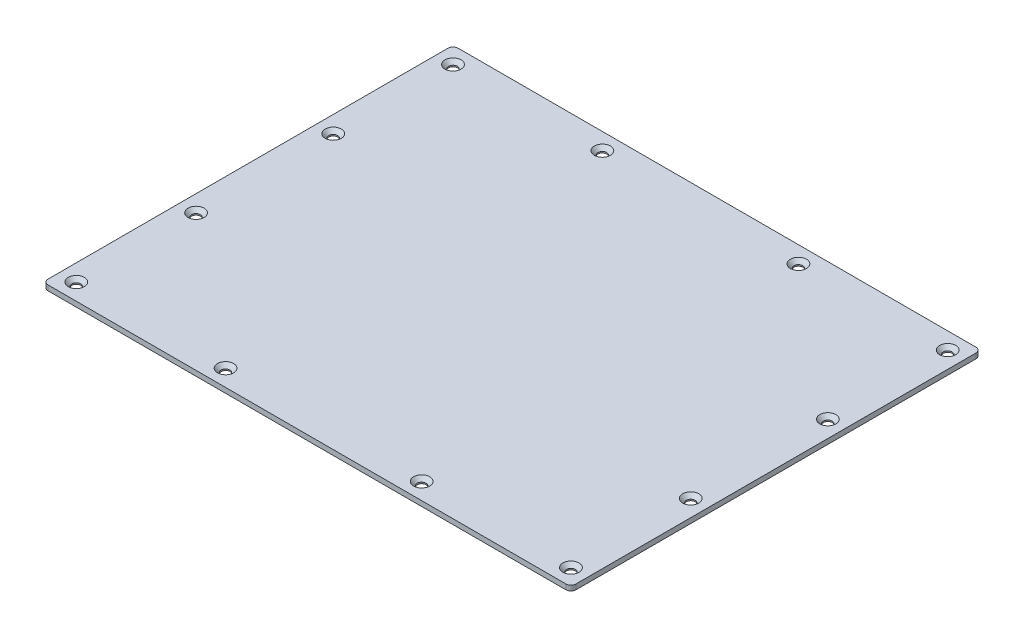
from build123d import *

# Parameters (mm, degrees)
BOSS_EXTRUDE1_DEPTH                            = 2
CSK_FOR_M3_FLAT_HEAD_MACHINE_SCREW1_AT_2_COUNT = 2
CSK_FOR_M3_FLAT_HEAD_MACHINE_SCREW1_AT_2_PITCH = 46.75
CSK_FOR_M3_FLAT_HEAD_MACHINE_SCREW1_AT_3_COUNT = 2
CSK_FOR_M3_FLAT_HEAD_MACHINE_SCREW1_AT_3_PITCH = 58.25
CSK_FOR_M3_FLAT_HEAD_MACHINE_SCREW1_AT_4_COUNT = 2
CSK_FOR_M3_FLAT_HEAD_MACHINE_SCREW1_AT_4_PITCH = 134.75
CSK_FOR_M3_FLAT_HEAD_MACHINE_SCREW1_AT_5_COUNT = 2
CSK_FOR_M3_FLAT_HEAD_MACHINE_SCREW1_AT_5_PITCH = 193
CSK_FOR_M3_FLAT_HEAD_MACHINE_SCREW1_AT_6_COUNT = 2
CSK_FOR_M3_FLAT_HEAD_MACHINE_SCREW1_AT_6_PITCH = 198.581375008
CSK_FOR_M3_FLAT_HEAD_MACHINE_SCREW1_AT_7_COUNT = 2
CSK_FOR_M3_FLAT_HEAD_MACHINE_SCREW1_AT_7_PITCH = 217.483476384
CSK_FOR_M3_FLAT_HEAD_MACHINE_SCREW1_AT_8_COUNT = 2
CSK_FOR_M3_FLAT_HEAD_MACHINE_SCREW1_AT_8_PITCH = 242.606677567
CSK_FOR_M3_FLAT_HEAD_MACHINE_SCREW1_AT_9_COUNT = 2
CSK_FOR_M3_FLAT_HEAD_MACHINE_SCREW1_AT_9_PITCH = 199.415552302
CSK_FOR_M3_FLAT_HEAD_MACHINE_SCREW1_AT_1_COUNT = 2
CSK_FOR_M3_FLAT_HEAD_MACHINE_SCREW1_AT_1_PITCH = 158.120405072
CSK_FOR_M3_FLAT_HEAD_MACHINE_SCREW1_2_COUNT    = 2
CSK_FOR_M3_FLAT_HEAD_MACHINE_SCREW1_2_PITCH    = 147
CSK_FOR_M3_FLAT_HEAD_MACHINE_SCREW1_3_COUNT    = 2
CSK_FOR_M3_FLAT_HEAD_MACHINE_SCREW1_3_PITCH    = 100.25


with BuildPart() as part:
    # Sketch1 → Boss-Extrude1 (new body)
    with BuildSketch(Plane(origin=(0, 0, 0), x_dir=(1, 0, 0), z_dir=(0, 1, 0))):
        with BuildLine():
            Line((103, -78), (103, 78))
            ThreePointArc((103, 78), (102.414213562, 79.414213562), (101, 80))
            Line((101, 80), (-101, 80))
            ThreePointArc((-101, 80), (-102.414213562, 79.414213562), (-103, 78))
            Line((-103, 78), (-103, -78))
            ThreePointArc((-103, -78), (-102.414213562, -79.414213562), (-101, -80))
            Line((-101, -80), (101, -80))
            ThreePointArc((101, -80), (102.414213562, -79.414213562), (103, -78))
        make_face()
    extrude(amount=BOSS_EXTRUDE1_DEPTH)

    # Sketch3 → CSK for M3 Flat Head Machine Screw1 (revolve, cut)
    with BuildSketch(Plane(origin=(-96.5, 2, -73.5), x_dir=(0, 0, 1), z_dir=(1, 0, 0))):
        Polygon((0, 0), (0, 2), (1.725, 2), (1.7, 1.975), (1.7, 1.45), (3.15, 0), align=None)
    csk_for_m3_flat_head_machine_screw1 = revolve(axis=Axis((-96.5, 8.35, -73.5), (0, -1, 0)), mode=Mode.SUBTRACT)

    # CSK for M3 Flat Head Machine Screw1 at 2: CSK for M3 Flat Head Machine Screw1 ×2
    with Locations(*[(0, 0, i * CSK_FOR_M3_FLAT_HEAD_MACHINE_SCREW1_AT_2_PITCH) for i in range(1, CSK_FOR_M3_FLAT_HEAD_MACHINE_SCREW1_AT_2_COUNT)]):
        add(csk_for_m3_flat_head_machine_screw1, mode=Mode.SUBTRACT)

    # CSK for M3 Flat Head Machine Screw1 at 3: CSK for M3 Flat Head Machine Screw1 ×2
    with Locations(*[(i * CSK_FOR_M3_FLAT_HEAD_MACHINE_SCREW1_AT_3_PITCH, 0, 0) for i in range(1, CSK_FOR_M3_FLAT_HEAD_MACHINE_SCREW1_AT_3_COUNT)]):
        add(csk_for_m3_flat_head_machine_screw1, mode=Mode.SUBTRACT)

    # CSK for M3 Flat Head Machine Screw1 at 4: CSK for M3 Flat Head Machine Screw1 ×2
    with Locations(*[(i * CSK_FOR_M3_FLAT_HEAD_MACHINE_SCREW1_AT_4_PITCH, 0, 0) for i in range(1, CSK_FOR_M3_FLAT_HEAD_MACHINE_SCREW1_AT_4_COUNT)]):
        add(csk_for_m3_flat_head_machine_screw1, mode=Mode.SUBTRACT)

    # CSK for M3 Flat Head Machine Screw1 at 5: CSK for M3 Flat Head Machine Screw1 ×2
    with Locations(*[(i * CSK_FOR_M3_FLAT_HEAD_MACHINE_SCREW1_AT_5_PITCH, 0, 0) for i in range(1, CSK_FOR_M3_FLAT_HEAD_MACHINE_SCREW1_AT_5_COUNT)]):
        add(csk_for_m3_flat_head_machine_screw1, mode=Mode.SUBTRACT)

    # CSK for M3 Flat Head Machine Screw1 at 6: CSK for M3 Flat Head Machine Screw1 ×2
    with Locations(*[Vector(0.9718937639161328, 0, 0.2354198625030021) * (i * CSK_FOR_M3_FLAT_HEAD_MACHINE_SCREW1_AT_6_PITCH) for i in range(1, CSK_FOR_M3_FLAT_HEAD_MACHINE_SCREW1_AT_6_COUNT)]):
        add(csk_for_m3_flat_head_machine_screw1, mode=Mode.SUBTRACT)

    # CSK for M3 Flat Head Machine Screw1 at 7: CSK for M3 Flat Head Machine Screw1 ×2
    with Locations(*[Vector(0.8874237399965582, 0, 0.46095455924691864) * (i * CSK_FOR_M3_FLAT_HEAD_MACHINE_SCREW1_AT_7_PITCH) for i in range(1, CSK_FOR_M3_FLAT_HEAD_MACHINE_SCREW1_AT_7_COUNT)]):
        add(csk_for_m3_flat_head_machine_screw1, mode=Mode.SUBTRACT)

    # CSK for M3 Flat Head Machine Screw1 at 8: CSK for M3 Flat Head Machine Screw1 ×2
    with Locations(*[Vector(0.7955263306668907, 0, 0.6059190186944727) * (i * CSK_FOR_M3_FLAT_HEAD_MACHINE_SCREW1_AT_8_PITCH) for i in range(1, CSK_FOR_M3_FLAT_HEAD_MACHINE_SCREW1_AT_8_COUNT)]):
        add(csk_for_m3_flat_head_machine_screw1, mode=Mode.SUBTRACT)

    # CSK for M3 Flat Head Machine Screw1 at 9: CSK for M3 Flat Head Machine Screw1 ×2
    with Locations(*[Vector(0.6757246285173452, 0, 0.7371541402007424) * (i * CSK_FOR_M3_FLAT_HEAD_MACHINE_SCREW1_AT_9_PITCH) for i in range(1, CSK_FOR_M3_FLAT_HEAD_MACHINE_SCREW1_AT_9_COUNT)]):
        add(csk_for_m3_flat_head_machine_screw1, mode=Mode.SUBTRACT)

    # CSK for M3 Flat Head Machine Screw1 at 1: CSK for M3 Flat Head Machine Screw1 ×2
    with Locations(*[Vector(0.3683901516292669, 0, 0.9296712839399558) * (i * CSK_FOR_M3_FLAT_HEAD_MACHINE_SCREW1_AT_1_PITCH) for i in range(1, CSK_FOR_M3_FLAT_HEAD_MACHINE_SCREW1_AT_1_COUNT)]):
        add(csk_for_m3_flat_head_machine_screw1, mode=Mode.SUBTRACT)

    # CSK for M3 Flat Head Machine Screw1  2: CSK for M3 Flat Head Machine Screw1 ×2
    with Locations(*[(0, 0, i * CSK_FOR_M3_FLAT_HEAD_MACHINE_SCREW1_2_PITCH) for i in range(1, CSK_FOR_M3_FLAT_HEAD_MACHINE_SCREW1_2_COUNT)]):
        add(csk_for_m3_flat_head_machine_screw1, mode=Mode.SUBTRACT)

    # CSK for M3 Flat Head Machine Screw1  3: CSK for M3 Flat Head Machine Screw1 ×2
    with Locations(*[(0, 0, i * CSK_FOR_M3_FLAT_HEAD_MACHINE_SCREW1_3_PITCH) for i in range(1, CSK_FOR_M3_FLAT_HEAD_MACHINE_SCREW1_3_COUNT)]):
        add(csk_for_m3_flat_head_machine_screw1, mode=Mode.SUBTRACT)


solid = part.part
